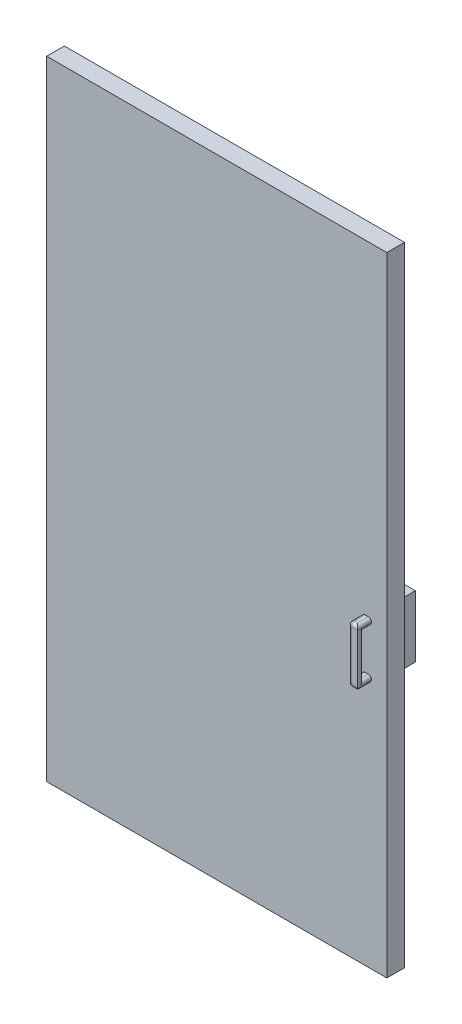
from build123d import *

# Parameters (mm, degrees)
BOSS_EXTRUDE2_DEPTH = 57.15
BOSS_EXTRUDE3_DEPTH = 44
CUT_EXTRUDE1_DEPTH  = 44
FILLET1_R           = 10
BOSS_EXTRUDE4_DEPTH = 100
SKETCH8_W           = 58.558244651631945
SKETCH8_H           = 158.82756414249673
CUT_EXTRUDE3_DEPTH  = 70


with BuildPart() as part:
    # Sketch1 → Boss-Extrude2 (new body)
    with BuildSketch(Plane.XY):
        Polygon((0, 0), (0, 446.2018372120283), (-1100, 446.2018372120282), (-1100, -1585.7981627879717), (0, -1585.7981627879717), align=None)
    extrude(amount=BOSS_EXTRUDE2_DEPTH)

    # Sketch4 → Boss-Extrude3 (add)
    with BuildSketch(Plane.XY.offset(57.15)):
        Polygon((-79.99999999999993, -603.7981627879718), (-49.999999999999936, -603.7981627879718), (-49.999999999999915, -785.7981627879718), (-79.9999999999999, -785.7981627879718), align=None)
    extrude(amount=BOSS_EXTRUDE3_DEPTH)

    # Sketch5 → Cut-Extrude1 (cut)
    with BuildSketch(Plane.ZY.offset(80.00000000000003)):
        Polygon((83.14999999999999, -624.7981627879717), (57.150000000000006, -624.7981627879717), (57.15, -764.7981627879717), (83.15, -764.7981627879717), align=None)
    extrude(amount=-CUT_EXTRUDE1_DEPTH, mode=Mode.SUBTRACT)

    # Fillet1
    # the kernel refuses this fillet: 10 mm, written as the material it takes off along each edge
    with BuildSketch(Plane(origin=(-69.99999999999993, -613.7981627879718, 91.15), x_dir=(-1, -1.6e-16, 0), z_dir=(0, 1, 0))) as fillet1_piece_1_section:
        Polygon((0, 0), (FILLET1_R, 0), (FILLET1_R, FILLET1_R), (0, FILLET1_R), align=None)
    fillet1_piece_1 = extrude(amount=FILLET1_R, mode=Mode.PRIVATE)
    fillet1_piece_1 = fillet1_piece_1 - Plane(origin=(-69.99999999999993, -613.7981627879718, 91.15), x_dir=(0.7071067811865475, 0, -0.7071067811865475), z_dir=(0, 1, 0)) * Sphere(FILLET1_R, mode=Mode.PRIVATE)
    add(fillet1_piece_1, mode=Mode.SUBTRACT)
    with BuildSketch(Plane(origin=(-69.9999999999999, -775.7981627879718, 91.15), x_dir=(0, 0, 1), z_dir=(-1, -1.6e-16, 0))) as fillet1_piece_2_section:
        Polygon((0, 0), (FILLET1_R, 0), (FILLET1_R, -FILLET1_R), (0, -FILLET1_R), align=None)
    fillet1_piece_2 = extrude(amount=FILLET1_R, mode=Mode.PRIVATE)
    fillet1_piece_2 = fillet1_piece_2 - Plane(origin=(-69.9999999999999, -775.7981627879718, 91.15), x_dir=(0, 0.7071067811865475, -0.7071067811865475), z_dir=(-1, -1.6e-16, 0)) * Sphere(FILLET1_R, mode=Mode.PRIVATE)
    add(fillet1_piece_2, mode=Mode.SUBTRACT)
    with BuildSketch(Plane(origin=(-49.999999999999915, -785.7981627879718, 57.15), x_dir=(-1, 0, 0), z_dir=(0, 0, 1))) as fillet1_piece_3:
        with BuildLine():
            CenterArc((FILLET1_R, -FILLET1_R), FILLET1_R, 90, 90)
            Line((0, -FILLET1_R), (0, 0))
            Line((0, 0), (FILLET1_R, 0))
        make_face()
    extrude(amount=69, mode=Mode.SUBTRACT)
    with BuildSketch(Plane(origin=(-49.999999999999936, -603.7981627879718, 57.15), x_dir=(0, -1, 0), z_dir=(0, 0, 1))) as fillet1_piece_4:
        with BuildLine():
            CenterArc((FILLET1_R, -FILLET1_R), FILLET1_R, 90, 90)
            Line((0, -FILLET1_R), (0, 0))
            Line((0, 0), (FILLET1_R, 0))
        make_face()
    extrude(amount=69, mode=Mode.SUBTRACT)
    with BuildSketch(Plane(origin=(-79.99999999999993, -603.7981627879718, 57.15), x_dir=(1, 0, 0), z_dir=(0, 0, 1))) as fillet1_piece_5:
        with BuildLine():
            CenterArc((FILLET1_R, -FILLET1_R), FILLET1_R, 90, 90)
            Line((0, -FILLET1_R), (0, 0))
            Line((0, 0), (FILLET1_R, 0))
        make_face()
    extrude(amount=34.00000000000001, mode=Mode.SUBTRACT)
    with BuildSketch(Plane(origin=(-79.9999999999999, -785.7981627879718, 57.15), x_dir=(1, 0, 0), z_dir=(0, 0, 1))) as fillet1_piece_6:
        with BuildLine():
            CenterArc((FILLET1_R, FILLET1_R), FILLET1_R, 180, 90)
            Line((0, FILLET1_R), (0, 0))
            Line((0, 0), (FILLET1_R, 0))
        make_face()
    extrude(amount=34.00000000000001, mode=Mode.SUBTRACT)
    with BuildSketch(Plane(origin=(-69.99999999999993, -603.7981627879718, 101.15), x_dir=(0, 0, -1), z_dir=(1, 0, 0))) as fillet1_piece_7:
        with BuildLine():
            CenterArc((FILLET1_R, -FILLET1_R), FILLET1_R, 90, 90)
            Line((0, -FILLET1_R), (0, 0))
            Line((0, 0), (FILLET1_R, 0))
        make_face()
    extrude(amount=44.99999999999999, mode=Mode.SUBTRACT)
    with BuildSketch(Plane(origin=(-79.9999999999999, -775.7981627879718, 101.15), x_dir=(0, 0, -1), z_dir=(-1.6e-16, 1, 0))) as fillet1_piece_8:
        with BuildLine():
            CenterArc((FILLET1_R, -FILLET1_R), FILLET1_R, 90, 90)
            Line((0, -FILLET1_R), (0, 0))
            Line((0, 0), (FILLET1_R, 0))
        make_face()
    extrude(amount=162, mode=Mode.SUBTRACT)
    with BuildSketch(Plane(origin=(-24.999999999999915, -785.7981627879718, 101.15), x_dir=(0, 0, -1), z_dir=(-1, 0, 0))) as fillet1_piece_9:
        with BuildLine():
            CenterArc((FILLET1_R, -FILLET1_R), FILLET1_R, 90, 90)
            Line((0, -FILLET1_R), (0, 0))
            Line((0, 0), (FILLET1_R, 0))
        make_face()
    extrude(amount=44.999999999999986, mode=Mode.SUBTRACT)
    with BuildSketch(Plane(origin=(-79.99999999999991, -764.7981627879717, 57.15000000000002), x_dir=(1.42e-15, -1, 0), z_dir=(0, 0, 1))) as fillet1_piece_10:
        with BuildLine():
            CenterArc((FILLET1_R, FILLET1_R), FILLET1_R, 180, 89.99999999999989)
            Line((1.421e-14, FILLET1_R), (0, 0))
            Line((0, 0), (FILLET1_R, 0))
        make_face()
    extrude(amount=25.999999999999986, mode=Mode.SUBTRACT)
    with BuildSketch(Plane(origin=(-79.99999999999993, -624.7981627879717, 83.14999999999999), x_dir=(0, 1, 0), z_dir=(0, 0, -1))) as fillet1_piece_11:
        with BuildLine():
            CenterArc((FILLET1_R, FILLET1_R), FILLET1_R, 180, 90)
            Line((0, FILLET1_R), (0, 0))
            Line((0, 0), (FILLET1_R, 0))
        make_face()
    extrude(amount=25.999999999999986, mode=Mode.SUBTRACT)
    with BuildSketch(Plane(origin=(-79.99999999999991, -764.7981627879717, 83.15), x_dir=(1.42e-15, 1e-16, 1), z_dir=(-1.5e-16, 1, -1e-16))) as fillet1_piece_12:
        with BuildLine():
            CenterArc((FILLET1_R, FILLET1_R), FILLET1_R, 180, 89.99999999999989)
            Line((1.421e-14, FILLET1_R), (0, 0))
            Line((0, 0), (FILLET1_R, 0))
        make_face()
    extrude(amount=140, mode=Mode.SUBTRACT)
    with BuildSketch(Plane(origin=(-49.999999999999915, -764.7981627879717, 83.15), x_dir=(0, -1, 0), z_dir=(0, 0, -1))) as fillet1_piece_13:
        with BuildLine():
            CenterArc((FILLET1_R, FILLET1_R), FILLET1_R, 180, 90)
            Line((0, FILLET1_R), (0, 0))
            Line((0, 0), (FILLET1_R, 0))
        make_face()
    extrude(amount=26, mode=Mode.SUBTRACT)
    with BuildSketch(Plane(origin=(-49.999999999999936, -624.7981627879717, 57.150000000000006), x_dir=(0, 1, 0), z_dir=(0, 0, 1))) as fillet1_piece_14:
        with BuildLine():
            CenterArc((FILLET1_R, FILLET1_R), FILLET1_R, 180.00000000000003, 90)
            Line((0, FILLET1_R), (0, 0))
            Line((0, 0), (FILLET1_R, 0))
        make_face()
    extrude(amount=25.999999999999986, mode=Mode.SUBTRACT)
    with BuildSketch(Plane(origin=(-49.999999999999936, -624.7981627879717, 83.15), x_dir=(0, 1e-16, 1), z_dir=(1.2e-16, -1, 1e-16))) as fillet1_piece_15:
        with BuildLine():
            CenterArc((FILLET1_R, FILLET1_R), FILLET1_R, 180, 90)
            Line((0, FILLET1_R), (0, 0))
            Line((0, 0), (FILLET1_R, 0))
        make_face()
    extrude(amount=140, mode=Mode.SUBTRACT)
    with BuildSketch(Plane(origin=(-79.99999999999991, -764.7981627879717, 57.15000000000002), x_dir=(1.42e-15, -1, 0), z_dir=(0, 0, 1))) as fillet1_piece_16a_section:
        with BuildLine():
            CenterArc((FILLET1_R, FILLET1_R), FILLET1_R, 180, 89.99999999999989)
            Line((1.421e-14, FILLET1_R), (0, 0))
            Line((0, 0), (FILLET1_R, 0))
        make_face()
    fillet1_piece_16a = extrude(amount=50.999999999999986, mode=Mode.PRIVATE)
    fillet1_piece_16a = split(fillet1_piece_16a, bisect_by=Plane(origin=(-77.7360488573316, -767.0621139306398, 83.15), z_dir=(0, 1e-16, 1)), keep=Keep.TOP, mode=Mode.PRIVATE)
    with BuildSketch(Plane(origin=(-79.9999999999999, -789.7981627879717, 83.15), x_dir=(0, 1e-16, 1), z_dir=(-1.5e-16, 1, -1e-16))) as fillet1_piece_16b_section:
        with BuildLine():
            CenterArc((FILLET1_R, FILLET1_R), FILLET1_R, 180, 90)
            Line((0, FILLET1_R), (0, 0))
            Line((0, 0), (FILLET1_R, 0))
        make_face()
    fillet1_piece_16b = extrude(amount=165, mode=Mode.PRIVATE)
    fillet1_piece_16b = split(fillet1_piece_16b, bisect_by=Plane(origin=(-77.73604885733165, -764.7981627879717, 85.41395114266827), z_dir=(1.5e-16, -1, 0)), keep=Keep.TOP, mode=Mode.PRIVATE)
    fillet1_piece_16 = fillet1_piece_16a & fillet1_piece_16b
    add(fillet1_piece_16, mode=Mode.SUBTRACT)
    with BuildSketch(Plane(origin=(-79.99999999999991, -764.7981627879717, 83.15), x_dir=(1.42e-15, 1e-16, 1), z_dir=(-1.5e-16, 1, -1e-16))) as fillet1_piece_17a_section:
        with BuildLine():
            CenterArc((FILLET1_R, FILLET1_R), FILLET1_R, 180, 89.99999999999989)
            Line((1.421e-14, FILLET1_R), (0, 0))
            Line((0, 0), (FILLET1_R, 0))
        make_face()
    fillet1_piece_17a = extrude(amount=165, mode=Mode.PRIVATE)
    fillet1_piece_17a = split(fillet1_piece_17a, bisect_by=Plane(origin=(-77.73604885733167, -624.7981627879717, 85.41395114266825), z_dir=(-1.5e-16, 1, 0)), keep=Keep.TOP, mode=Mode.PRIVATE)
    with BuildSketch(Plane(origin=(-79.99999999999993, -624.7981627879717, 108.14999999999998), x_dir=(0, 1, 0), z_dir=(0, 0, -1))) as fillet1_piece_17b_section:
        with BuildLine():
            CenterArc((FILLET1_R, FILLET1_R), FILLET1_R, 180, 90)
            Line((0, FILLET1_R), (0, 0))
            Line((0, 0), (FILLET1_R, 0))
        make_face()
    fillet1_piece_17b = extrude(amount=50.999999999999986, mode=Mode.PRIVATE)
    fillet1_piece_17b = split(fillet1_piece_17b, bisect_by=Plane(origin=(-77.73604885733164, -622.5342116453035, 83.14999999999999), z_dir=(0, 1e-16, 1)), keep=Keep.TOP, mode=Mode.PRIVATE)
    fillet1_piece_17 = fillet1_piece_17a & fillet1_piece_17b
    add(fillet1_piece_17, mode=Mode.SUBTRACT)
    with BuildSketch(Plane(origin=(-49.999999999999936, -624.7981627879717, 83.15), x_dir=(0, 1e-16, 1), z_dir=(1.2e-16, -1, 1e-16))) as fillet1_piece_18a_section:
        with BuildLine():
            CenterArc((FILLET1_R, FILLET1_R), FILLET1_R, 180, 90)
            Line((0, FILLET1_R), (0, 0))
            Line((0, 0), (FILLET1_R, 0))
        make_face()
    fillet1_piece_18a = extrude(amount=165, mode=Mode.PRIVATE)
    fillet1_piece_18a = split(fillet1_piece_18a, bisect_by=Plane(origin=(-52.26395114266817, -764.7981627879717, 85.41395114266827), z_dir=(1.5e-16, -1, 0)), keep=Keep.TOP, mode=Mode.PRIVATE)
    with BuildSketch(Plane(origin=(-49.999999999999915, -764.7981627879717, 108.15), x_dir=(0, -1, 0), z_dir=(0, 0, -1))) as fillet1_piece_18b_section:
        with BuildLine():
            CenterArc((FILLET1_R, FILLET1_R), FILLET1_R, 180, 90)
            Line((0, FILLET1_R), (0, 0))
            Line((0, 0), (FILLET1_R, 0))
        make_face()
    fillet1_piece_18b = extrude(amount=51, mode=Mode.PRIVATE)
    fillet1_piece_18b = split(fillet1_piece_18b, bisect_by=Plane(origin=(-52.2639511426682, -767.0621139306397, 83.15), z_dir=(0, 1e-16, 1)), keep=Keep.TOP, mode=Mode.PRIVATE)
    fillet1_piece_18 = fillet1_piece_18a & fillet1_piece_18b
    add(fillet1_piece_18, mode=Mode.SUBTRACT)
    with BuildSketch(Plane(origin=(-49.999999999999936, -624.7981627879717, 57.150000000000006), x_dir=(0, 1, 0), z_dir=(0, 0, 1))) as fillet1_piece_19a_section:
        with BuildLine():
            CenterArc((FILLET1_R, FILLET1_R), FILLET1_R, 180.00000000000003, 90)
            Line((0, FILLET1_R), (0, 0))
            Line((0, 0), (FILLET1_R, 0))
        make_face()
    fillet1_piece_19a = extrude(amount=50.999999999999986, mode=Mode.PRIVATE)
    fillet1_piece_19a = split(fillet1_piece_19a, bisect_by=Plane(origin=(-52.26395114266823, -622.5342116453035, 83.14999999999999), z_dir=(0, 1e-16, 1)), keep=Keep.TOP, mode=Mode.PRIVATE)
    with BuildSketch(Plane(origin=(-49.999999999999936, -599.7981627879717, 83.14999999999999), x_dir=(0, 1e-16, 1), z_dir=(1.2e-16, -1, 1e-16))) as fillet1_piece_19b_section:
        with BuildLine():
            CenterArc((FILLET1_R, FILLET1_R), FILLET1_R, 179.99999999999997, 90)
            Line((0, FILLET1_R), (0, 0))
            Line((0, 0), (FILLET1_R, 0))
        make_face()
    fillet1_piece_19b = extrude(amount=165, mode=Mode.PRIVATE)
    fillet1_piece_19b = split(fillet1_piece_19b, bisect_by=Plane(origin=(-52.26395114266818, -624.7981627879717, 85.41395114266824), z_dir=(-1.5e-16, 1, 0)), keep=Keep.TOP, mode=Mode.PRIVATE)
    fillet1_piece_19 = fillet1_piece_19a & fillet1_piece_19b
    add(fillet1_piece_19, mode=Mode.SUBTRACT)

    # Sketch6 → Boss-Extrude4 (add)
    with BuildSketch(Plane(origin=(0, 0, 0), x_dir=(-1, 0, 0), z_dir=(0, 0, -1))):
        Polygon((64.99999999999997, -612.0487005102074), (134.99999999999994, -612.0487005102074), (135, -812.0487005102073), (65, -812.0487005102073), align=None)
    extrude(amount=BOSS_EXTRUDE4_DEPTH)

    # Sketch8 → Cut-Extrude3 (cut)
    with BuildSketch(Plane(origin=(-64.99999999999989, 9.02e-15, 0), x_dir=(0, 0, -1), z_dir=(1, -1.4e-16, 0))):
        with Locations((29.279122325815973, -707.3493580183326)):
            Rectangle(SKETCH8_W, SKETCH8_H)
    extrude(amount=-CUT_EXTRUDE3_DEPTH, mode=Mode.SUBTRACT)


solid = part.part
